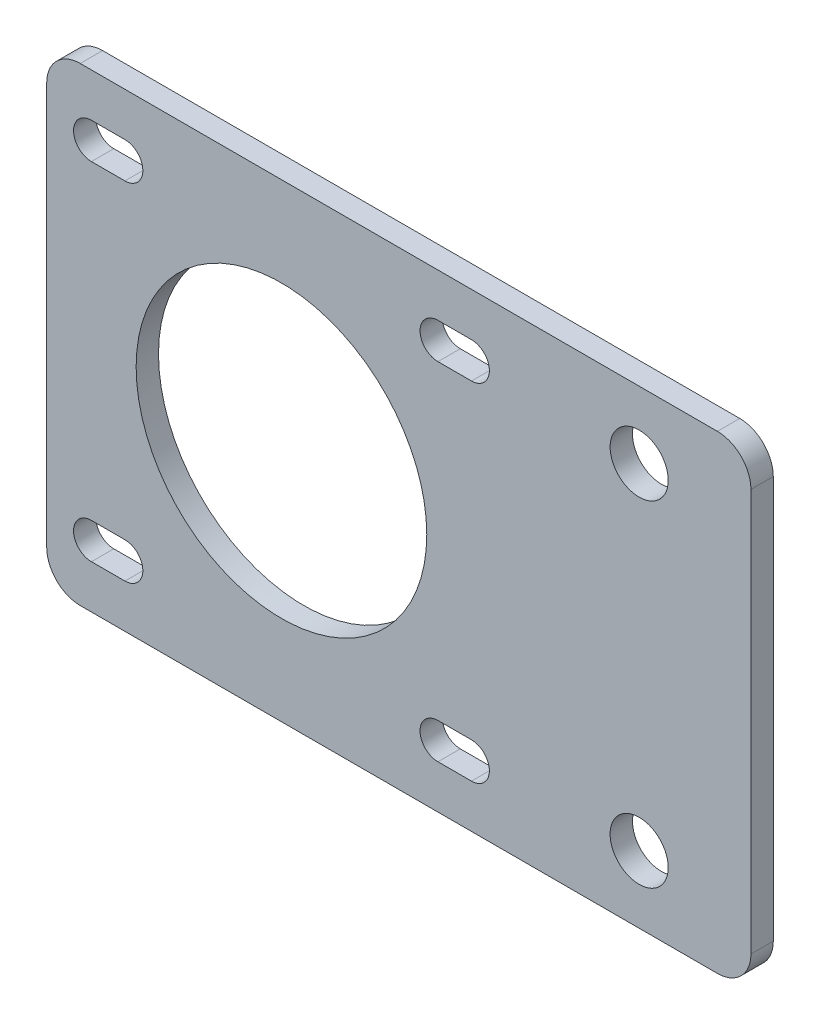
from build123d import *

# Parameters (mm, degrees)
SKETCH_1_R             = 13
SKETCH_1_R_2           = 2.6
SM_BASE_FLANGE_1_DEPTH = 2


# Sheet-metal steps are written as plain solids
with BuildPart() as part:
    # Sketch 1 → 基体-法兰1 (new body)
    with BuildSketch(Plane.XY):
        with BuildLine():
            Line((42, 18), (42, -18))
            ThreePointArc((42, -18), (41.121320344, -20.121320344), (39, -21))
            Line((39, -21), (-18, -21))
            ThreePointArc((-18, -21), (-20.121320344, -20.121320344), (-21, -18))
            Line((-21, -18), (-21, 18))
            ThreePointArc((-21, 18), (-20.121320344, 20.121320344), (-18, 21))
            Line((-18, 21), (39, 21))
            ThreePointArc((39, 21), (41.121320344, 20.121320344), (42, 18))
        make_face()
        Circle(SKETCH_1_R, mode=Mode.SUBTRACT)
        with Locations((32, 15)):
            Circle(SKETCH_1_R_2, mode=Mode.SUBTRACT)
        with Locations((32, -15)):
            Circle(SKETCH_1_R_2, mode=Mode.SUBTRACT)
        with BuildLine():
            Line((-14, 13.9), (-17, 13.9))
            ThreePointArc((-17, 13.9), (-18.6, 15.5), (-17, 17.1))
            Line((-17, 17.1), (-14, 17.1))
            ThreePointArc((-14, 17.1), (-12.4, 15.5), (-14, 13.9))
        make_face(mode=Mode.SUBTRACT)
        with BuildLine():
            Line((-14, -17.1), (-17, -17.1))
            ThreePointArc((-17, -17.1), (-18.6, -15.5), (-17, -13.9))
            Line((-17, -13.9), (-14, -13.9))
            ThreePointArc((-14, -13.9), (-12.4, -15.5), (-14, -17.1))
        make_face(mode=Mode.SUBTRACT)
        with BuildLine():
            Line((17, 13.9), (14, 13.9))
            ThreePointArc((14, 13.9), (12.4, 15.5), (14, 17.1))
            Line((14, 17.1), (17, 17.1))
            ThreePointArc((17, 17.1), (18.6, 15.5), (17, 13.9))
        make_face(mode=Mode.SUBTRACT)
        with BuildLine():
            Line((17, -17.1), (14, -17.1))
            ThreePointArc((14, -17.1), (12.4, -15.5), (14, -13.9))
            Line((14, -13.9), (17, -13.9))
            ThreePointArc((17, -13.9), (18.6, -15.5), (17, -17.1))
        make_face(mode=Mode.SUBTRACT)
    extrude(amount=-SM_BASE_FLANGE_1_DEPTH)


solid = part.part
